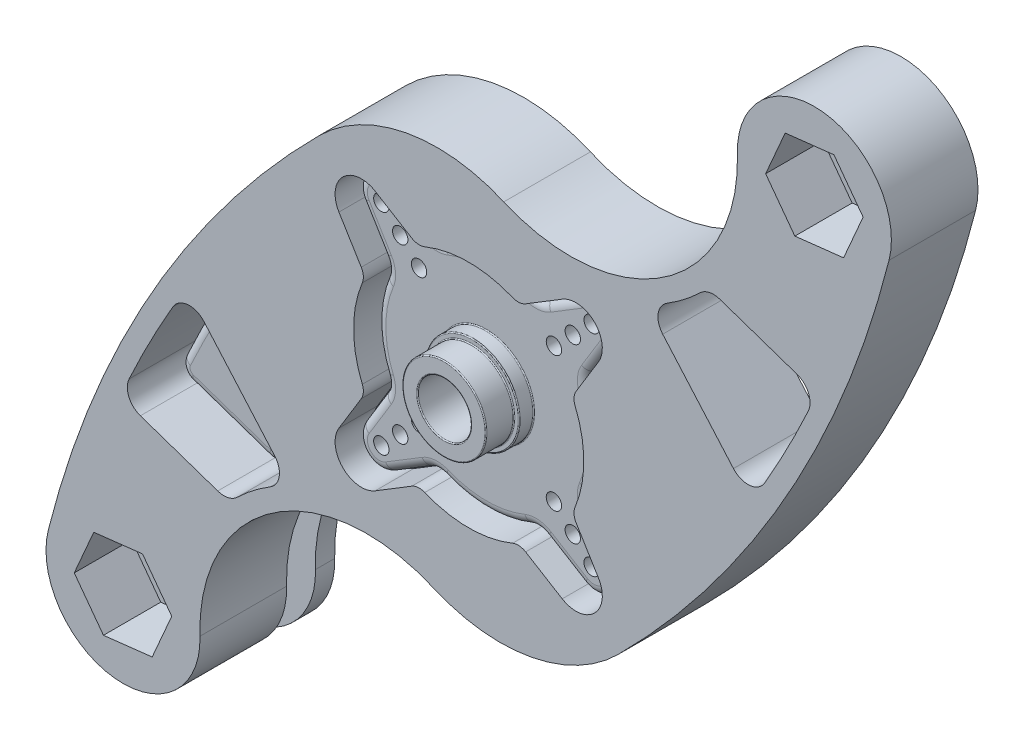
from build123d import *

# Parameters (mm, degrees)
SKETCH2_W                = 14.055
SKETCH2_H                = 14.055
BOSS_EXTRUDE1_DEPTH      = 2.15
CUT_EXTRUDE3_DEPTH       = 2.15
CUT_EXTRUDE1_DEPTH       = 20.526400209
CUT_EXTRUDE1_DEPTH_BACK  = 2.15
SKETCH5_R                = 0.8
CUT_EXTRUDE4_DEPTH       = 2.15
FILLET1_R                = 2
FILLET2_R                = 1
BOSS_EXTRUDE2_DEPTH      = 1.5
BOSS_EXTRUDE3_DEPTH      = 2.9
FILLET3_R                = 0.1
CUT_EXTRUDE5_DEPTH       = 1.4
BOSS_EXTRUDE4_DEPTH      = 0.001
BOSS_EXTRUDE4_DEPTH_BACK = 4
SKETCH9_R                = 2.159
SKETCH10_R               = 0.8
SKETCH10_R_2             = 2.159
BOSS_EXTRUDE5_DEPTH      = 5
CUT_EXTRUDE10_DEPTH      = 5.953125
CUT_EXTRUDE12_DEPTH      = 55.354957559
FILLET6_R                = 2
CIRPATTERN1_COUNT        = 2
SKETCH19_W               = 1.06316562
SKETCH19_H               = 3.057820662
SKETCH19_W_2             = 3.570982962
SKETCH19_H_2             = 3.570982962
BOSS_EXTRUDE12_DEPTH     = 4
BOSS_EXTRUDE14_START     = 3
SKETCH21_R               = 2.159
BOSS_EXTRUDE14_DEPTH     = 2
SKETCH22_R               = 3
SKETCH22_R_2             = 2.159
BOSS_EXTRUDE15_DEPTH     = 2.99
BOSS_EXTRUDE16_DEPTH     = 4
FILLET7_R                = 1


with BuildPart() as part:
    # Sketch2 → Boss-Extrude1 (new body)
    with BuildSketch(Plane.XY):
        with Locations((7.0275, 7.0275)):
            Rectangle(SKETCH2_W, SKETCH2_H)
    extrude(amount=BOSS_EXTRUDE1_DEPTH)

    # Sketch3 → Cut-Extrude3 (cut)
    with BuildSketch(Plane.XY.offset(2.15)):
        with BuildLine():
            Line((0.999100021, 9.979985481), (3.875887884, 5.264719986))
            ThreePointArc((3.875887884, 5.264719986), (2.919825443, 2.709148866), (2.595, 0))
            Line((2.595, 0), (0, 0))
            Line((0, 0), (0, 14.055))
            Line((0, 14.055), (14.055, 14.055))
            Line((14.055, 14.055), (14.055, 11.46))
            ThreePointArc((14.055, 11.46), (11.345851134, 11.135174557), (8.790280014, 10.179112116))
            Line((8.790280014, 10.179112116), (4.075014519, 13.055899979))
            ThreePointArc((4.075014519, 13.055899979), (1.327077939, 12.727922061), (0.999100021, 9.979985481))
        make_face()
    extrude(amount=-CUT_EXTRUDE3_DEPTH, mode=Mode.SUBTRACT)

    # Sketch4 → Cut-Extrude1 (cut, two sides: drawn at the far end of the back side and taken through both)
    with BuildSketch(Plane.XY.offset(2.15).offset(-CUT_EXTRUDE1_DEPTH_BACK)):
        with BuildLine():
            Line((59.770936163, 1.56), (14.055, 1.56))
            ThreePointArc((14.055, 1.56), (12.951913421, 1.103086579), (12.495, 0))
            Line((12.495, 0), (12.495, -45.715936163))
            Line((12.495, -45.715936163), (77.147096938, -110.368033101))
            Line((77.147096938, -110.368033101), (124.423033101, -63.092096938))
            Line((124.423033101, -63.092096938), (59.770936163, 1.56))
        make_face()
    extrude(amount=CUT_EXTRUDE1_DEPTH + CUT_EXTRUDE1_DEPTH_BACK, mode=Mode.SUBTRACT)

    # Sketch5 → Cut-Extrude4 (cut)
    with BuildSketch(Plane.XY.offset(2.15)):
        with Locations((7.047571798, 7.007428202)):
            Circle(SKETCH5_R)
        with Locations((5.088886015, 8.966113985)):
            Circle(SKETCH5_R)
        with Locations((3.130200231, 10.924799769)):
            Circle(SKETCH5_R)
    extrude(amount=-CUT_EXTRUDE4_DEPTH, mode=Mode.SUBTRACT)

    # Fillet1
    fillet1_edges = [part.edges().sort_by_distance(p)[0] for p in [
        (8.790280014, 10.179112116, 1.075),
        (3.875887884, 5.264719986, 1.075),
    ]]
    fillet(fillet1_edges, radius=FILLET1_R)

    # Fillet2
    fillet2_edges = [part.edges().sort_by_distance(p)[0] for p in [
        (2.813701606, 2.228185453, 2.15),
        (1.327077939, 12.727922061, 2.15),
        (5.977080248, 11.895447909, 2.15),
        (11.826814547, 11.241298394, 2.15),
        (2.159552091, 8.077919752, 2.15),
        (8.764491726, 10.448443083, 2.15),
        (3.606556917, 5.290508274, 2.15),
    ]]
    fillet(fillet2_edges, radius=FILLET2_R)

    # Sketch6 → Boss-Extrude2 (add)
    with BuildSketch(Plane.XY.offset(2.15)):
        with BuildLine():
            Line((14.055, 4.9), (14.055, 2.765))
            ThreePointArc((14.055, 2.765), (12.09984975, 1.95515025), (11.29, 0))
            Line((11.29, 0), (9.155, 0))
            ThreePointArc((9.155, 0), (10.590176772, 3.464823228), (14.055, 4.9))
        make_face()
    extrude(amount=BOSS_EXTRUDE2_DEPTH)

    # Sketch7 → Boss-Extrude3 (add)
    with BuildSketch(Plane.XY.offset(3.65)):
        with BuildLine():
            Line((14.055, 4.35), (14.055, 2.765))
            ThreePointArc((14.055, 2.765), (12.09984975, 1.95515025), (11.29, 0))
            Line((11.29, 0), (9.705, 0))
            ThreePointArc((9.705, 0), (10.979085502, 3.075914498), (14.055, 4.35))
        make_face()
    extrude(amount=BOSS_EXTRUDE3_DEPTH)

    # Fillet3
    fillet3_edges = [part.edges().sort_by_distance(p)[0] for p in [
        (10.590176772, 3.464823228, 2.15),
        (10.590176772, 3.464823228, 3.65),
        (10.979085502, 3.075914498, 3.65),
        (12.09984975, 1.95515025, 6.55),
        (10.979085502, 3.075914498, 6.55),
    ]]
    fillet(fillet3_edges, radius=FILLET3_R)

    # Sketch8 → Cut-Extrude5 (cut)
    with BuildSketch(Plane(origin=(0, 0, 0), x_dir=(-1, 0, 0), z_dir=(0, 0, -1))):
        with BuildLine():
            Line((-12.495, 0), (-11.305, 0))
            ThreePointArc((-11.305, 0), (-12.110456352, 1.944543648), (-14.055, 2.75))
            Line((-14.055, 2.75), (-14.055, 1.56))
            ThreePointArc((-14.055, 1.56), (-12.951913421, 1.103086579), (-12.495, 0))
        make_face()
    extrude(amount=-CUT_EXTRUDE5_DEPTH, mode=Mode.SUBTRACT)

    # Mirror1: part across plane


with BuildPart() as part_1:
    add(part.part)
    add(part.part.mirror(Plane(origin=(0, 0, 2.15), x_dir=(0, 0, 1), z_dir=(0, 1, 0))))

    # Mirror2: part across plane


with BuildPart() as part_2:
    add(part_1.part)
    add(part_1.part.mirror(Plane(origin=(14.055, 0, 2.15), x_dir=(0, 0, 1), z_dir=(-1, 0, 0))))


with BuildPart() as body_2:
    # Sketch9 → Boss-Extrude4 (new, two sides: drawn at the far end of the back side and taken through both)
    with BuildSketch(Plane(origin=(0, 0, 0), x_dir=(-1, 0, 0), z_dir=(0, 0, -1)).offset(-BOSS_EXTRUDE4_DEPTH_BACK)):
        with BuildLine():
            Line((-27.136475452, -13.081475452), (-29.611349186, -15.556349186))
            ThreePointArc((-29.611349186, -15.556349186), (-20.571985351, -20.337412361), (-10.409330987, -19.202018199))
            ThreePointArc((-10.409330987, -19.202018199), (6.261551174, -20.755669819), (13.869956346, -35.670237065))
            ThreePointArc((13.869956346, -35.670237065), (22.729197976, -43.874321381), (29.622114724, -33.960650999))
            ThreePointArc((29.622114724, -33.960650999), (18.910907383, -7.300150046), (1.501349186, 15.556349186))
            Line((1.501349186, 15.556349186), (-0.973524548, 13.081475452))
            ThreePointArc((-0.973524548, 13.081475452), (-0.190918114, 11.469986498), (-0.57226737, 9.719574483))
            Line((-0.57226737, 9.719574483), (-2.89317151, 5.915443025))
            ThreePointArc((-2.89317151, 5.915443025), (-3.108086077, 5.251433714), (-2.999262684, 4.562046953))
            ThreePointArc((-2.999262684, 4.562046953), (-2.095, 0), (-2.999262684, -4.562046953))
            ThreePointArc((-2.999262684, -4.562046953), (-3.108086077, -5.251433714), (-2.89317151, -5.915443025))
            Line((-2.89317151, -5.915443025), (-0.57226737, -9.719574483))
            ThreePointArc((-0.57226737, -9.719574483), (-0.973524548, -13.081475452), (-4.335425517, -13.48273263))
            Line((-4.335425517, -13.48273263), (-8.139556975, -11.16182849))
            ThreePointArc((-8.139556975, -11.16182849), (-8.803566286, -10.946913923), (-9.492953047, -11.055737316))
            ThreePointArc((-9.492953047, -11.055737316), (-14.055, -11.96), (-18.617046953, -11.055737316))
            ThreePointArc((-18.617046953, -11.055737316), (-19.306433714, -10.946913923), (-19.970443025, -11.16182849))
            Line((-19.970443025, -11.16182849), (-23.774574483, -13.48273263))
            ThreePointArc((-23.774574483, -13.48273263), (-25.524986498, -13.864081886), (-27.136475452, -13.081475452))
        make_face()
        with Locations((21.866024484, -35.921024484)):
            Circle(SKETCH9_R, mode=Mode.SUBTRACT)
    extrude(amount=BOSS_EXTRUDE4_DEPTH + BOSS_EXTRUDE4_DEPTH_BACK)

    # Sketch10 → Boss-Extrude5 (add)
    with BuildSketch(Plane(origin=(0, 0, -0.001), x_dir=(-1, 0, 0), z_dir=(0, 0, -1))):
        with BuildLine():
            Line((1.501349186, 15.556349186), (-2.564514806, 11.490485194))
            ThreePointArc((-2.564514806, 11.490485194), (-2.564514806, 10.359114344), (-3.695885656, 10.359114344))
            Line((-3.695885656, 10.359114344), (-4.52320059, 9.53179941))
            ThreePointArc((-4.52320059, 9.53179941), (-4.52320059, 8.40042856), (-5.65457144, 8.40042856))
            Line((-5.65457144, 8.40042856), (-6.481886373, 7.573113627))
            ThreePointArc((-6.481886373, 7.573113627), (-6.481886373, 6.441742777), (-7.613257223, 6.441742777))
            Line((-7.613257223, 6.441742777), (-12.110456352, 1.944543648))
            ThreePointArc((-12.110456352, 1.944543648), (-12.110456352, -1.944543648), (-15.999543648, -1.944543648))
            Line((-15.999543648, -1.944543648), (-20.496742777, -6.441742777))
            ThreePointArc((-20.496742777, -6.441742777), (-20.496742777, -7.573113627), (-21.628113627, -7.573113627))
            Line((-21.628113627, -7.573113627), (-22.45542856, -8.40042856))
            ThreePointArc((-22.45542856, -8.40042856), (-22.45542856, -9.53179941), (-23.58679941, -9.53179941))
            Line((-23.58679941, -9.53179941), (-24.414114344, -10.359114344))
            ThreePointArc((-24.414114344, -10.359114344), (-24.414114344, -11.490485194), (-25.545485194, -11.490485194))
            Line((-25.545485194, -11.490485194), (-29.611349186, -15.556349186))
            ThreePointArc((-29.611349186, -15.556349186), (-20.571985351, -20.337412361), (-10.409330987, -19.202018199))
            ThreePointArc((-10.409330987, -19.202018199), (6.261551174, -20.755669819), (13.869956346, -35.670237065))
            ThreePointArc((13.869956346, -35.670237065), (22.729197976, -43.874321381), (29.622114724, -33.960650999))
            ThreePointArc((29.622114724, -33.960650999), (18.910907383, -7.300150046), (1.501349186, 15.556349186))
        make_face()
        with Locations((-3.130200231, -10.924799769)):
            Circle(SKETCH10_R, mode=Mode.SUBTRACT)
        with Locations((-5.088886015, -8.966113985)):
            Circle(SKETCH10_R, mode=Mode.SUBTRACT)
        with Locations((-7.047571798, -7.007428202)):
            Circle(SKETCH10_R, mode=Mode.SUBTRACT)
        with Locations((21.866024484, -35.921024484)):
            Circle(SKETCH10_R_2, mode=Mode.SUBTRACT)
    extrude(amount=BOSS_EXTRUDE5_DEPTH)

    # Sketch13 → Cut-Extrude10 (cut)
    with BuildSketch(Plane.XY.offset(4)):
        Polygon((-19.836370966, -31.244472343), (-24.901210681, -31.825016906), (-26.9308642, -36.501569047), (-23.895678003, -40.597576625), (-18.830838287, -40.017032063), (-16.801184769, -35.340479922), align=None)
    extrude(amount=-CUT_EXTRUDE10_DEPTH, mode=Mode.SUBTRACT)

    # Sketch16 → Cut-Extrude12 (cut, through all)
    with BuildSketch(Plane(origin=(0, 0, -5.001), x_dir=(-1, 0, 0), z_dir=(0, 0, -1))):
        with BuildLine():
            Line((10.824364194, -22.080129282), (22.137058109, -18.217674595))
            ThreePointArc((22.137058109, -18.217674595), (18.93377908, -11.520975077), (15.266071026, -5.066929941))
            Line((15.266071026, -5.066929941), (4.438556963, -17.457453458))
            ThreePointArc((4.438556963, -17.457453458), (7.869194278, -19.440383833), (10.824364194, -22.080129282))
        make_face()
    extrude(amount=-CUT_EXTRUDE12_DEPTH, mode=Mode.SUBTRACT)

    # Fillet6
    fillet6_edges = [body_2.edges().sort_by_distance(p)[0] for p in [
        (-10.824364194, -22.080129282, -0.5005),
        (-4.438556963, -17.457453458, -0.5005),
        (-15.266071026, -5.066929941, -0.5005),
        (-22.137058109, -18.217674595, -0.5005),
    ]]
    fillet(fillet6_edges, radius=FILLET6_R)


with BuildPart() as cirpattern1_1:
    # CirPattern1: pattern copy
    add(body_2.part.rotate(Axis((14.055, 0, 0), (0, 0, 1)), 1 * 360 / CIRPATTERN1_COUNT))


with BuildPart() as body_2_1:
    add(body_2.part)

    add(cirpattern1_1.part)  # Boss-Extrude12 merges CirPattern1_1
    # Sketch19 → Boss-Extrude12 (add)
    with BuildSketch(Plane(origin=(0, 0, -5.001), x_dir=(-1, 0, 0), z_dir=(0, 0, -1))):
        with Locations((-0.53158281, 13.52341719)):
            Rectangle(SKETCH19_W, SKETCH19_H)
        with Locations((-27.57841719, -13.52341719)):
            Rectangle(SKETCH19_W_2, SKETCH19_H_2)
    extrude(amount=-BOSS_EXTRUDE12_DEPTH)


with BuildPart() as body_3:
    # Sketch21 → Boss-Extrude14 (new body)
    with BuildSketch(Plane(origin=(0, 0, -5.001), x_dir=(-1, 0, 0), z_dir=(0, 0, -1)).offset(BOSS_EXTRUDE14_START)):
        with BuildLine():
            Line((4.597143699, -14.236533708), (1.001204582, -18.351565831))
            ThreePointArc((1.001204582, -18.351565831), (10.452000604, -24.769530763), (13.869956346, -35.670237065))
            ThreePointArc((13.869956346, -35.670237065), (22.729197976, -43.874321381), (29.622114724, -33.960650999))
            ThreePointArc((29.622114724, -33.960650999), (23.903443926, -17.265029697), (15.522245819, -1.734334778))
            Line((15.522245819, -1.734334778), (11.949595771, -5.822715931))
            Line((11.949595771, -5.822715931), (4.597143699, -14.236533708))
        make_face()
        with Locations((21.866024484, -35.921024484)):
            Circle(SKETCH21_R, mode=Mode.SUBTRACT)
    extrude(amount=BOSS_EXTRUDE14_DEPTH)

    # Sketch22 → Boss-Extrude15 (add)
    # profile 1 of 2: a face of its own
    with BuildSketch(Plane.XY.offset(-8.001)):
        with Locations(Location((-21.866024484, -35.921024484, 0), (0, 0, 180))):
            Circle(SKETCH22_R)
        with Locations(Location((-21.866024484, -35.921024484, 0), (0, 0, 180))):
            Circle(SKETCH22_R_2, mode=Mode.SUBTRACT)
    # profile 2 of 2: a face of its own
    with BuildSketch(Plane.XY.offset(-8.001)):
        with BuildLine():
            Line((-10.180194614, -24.413425446), (-24.816783462, -19.416104594))
            ThreePointArc((-24.816783462, -19.416104594), (-20.582401166, -10.35818319), (-15.522245819, -1.734334778))
            Line((-15.522245819, -1.734334778), (-1.001204582, -18.351565831))
            ThreePointArc((-1.001204582, -18.351565831), (-6.083403128, -20.636434021), (-10.180194614, -24.413425446))
        make_face()
    extrude(amount=BOSS_EXTRUDE15_DEPTH)

    # Sketch23 → Boss-Extrude16 (add)
    with BuildSketch(Plane.XY.offset(-5.011)):
        with BuildLine():
            Line((-11.860948985, -21.197871772), (-19.899431607, -18.453319934))
            ThreePointArc((-19.899431607, -18.453319934), (-20.79346002, -17.624705127), (-20.777003228, -16.40584563))
            ThreePointArc((-20.777003228, -16.40584563), (-18.620044988, -12.001036725), (-16.259104927, -7.70210984))
            ThreePointArc((-16.259104927, -7.70210984), (-15.1057832, -6.961724117), (-13.832105827, -7.467755714))
            Line((-13.832105827, -7.467755714), (-6.479653755, -15.881573491))
            ThreePointArc((-6.479653755, -15.881573491), (-6.126746903, -17.097621455), (-6.830185005, -18.150470321))
            ThreePointArc((-6.830185005, -18.150470321), (-8.657080939, -19.405333792), (-10.332810018, -20.855907176))
            ThreePointArc((-10.332810018, -20.855907176), (-11.048713847, -21.242127585), (-11.860948985, -21.197871772))
        make_face()
    extrude(amount=BOSS_EXTRUDE16_DEPTH)

    # Fillet7
    fillet7_edges = [body_3.edges().sort_by_distance(p)[0] for p in [
        (-8.657080939, -19.405333792, -1.011),
        (-6.126746903, -17.097621455, -1.011),
        (-10.155879791, -11.674664602, -1.011),
        (-15.1057832, -6.961724117, -1.011),
        (-18.620044988, -12.001036725, -1.011),
        (-20.79346002, -17.624705127, -1.011),
        (-15.880190296, -19.825595853, -1.011),
        (-11.048713847, -21.242127585, -1.011),
    ]]
    fillet(fillet7_edges, radius=FILLET7_R)


solid = Compound([part_2.part, body_2_1.part, body_3.part])
